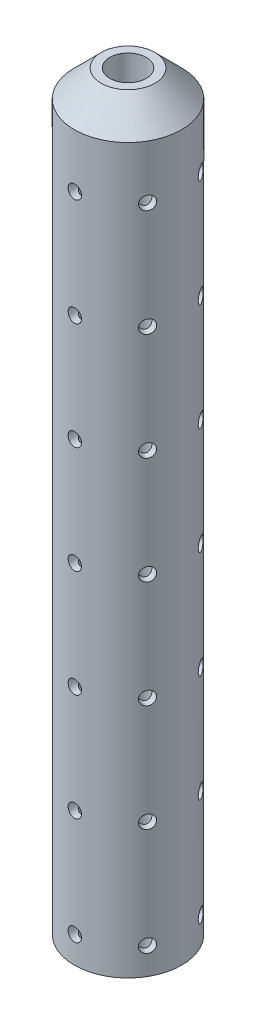
from build123d import *

# Parameters (mm, degrees)
SKETCH1_R               = 6.35
BOSS_EXTRUDE1_DEPTH     = 85.725
SKETCH2_R               = 6.35
SKETCH2_R_2             = 2.159
BOSS_EXTRUDE2_DEPTH     = 3.175
CHAMFER1_SIZE           = 3.175
SKETCH4_R               = 0.79375
CUT_EXTRUDE1_DEPTH      = 85.725
CUT_EXTRUDE2_REACH      = 93.14
CUT_EXTRUDE2_END_RADIUS = 0.79375
SKETCH3_R               = 0.79375
CIRPATTERN1_COUNT       = 6


with BuildPart() as part:
    # Sketch1 → Boss-Extrude1 (new body)
    with BuildSketch(Plane(origin=(0, 0, 0), x_dir=(1, 0, 0), z_dir=(0, 1, 0))):
        Circle(SKETCH1_R)
        Polygon((3.695503603, 0), (1.847751802, 3.2004), (-1.847751802, 3.2004), (-3.695503603, 0), (-1.847751802, -3.2004), (1.847751802, -3.2004), align=None, mode=Mode.SUBTRACT)
    extrude(amount=BOSS_EXTRUDE1_DEPTH)

    # Sketch2 → Boss-Extrude2 (add)
    with BuildSketch(Plane(origin=(0, 85.725, 0), x_dir=(1, 0, 0), z_dir=(0, 1, 0))):
        Circle(SKETCH2_R)
        Circle(SKETCH2_R_2, mode=Mode.SUBTRACT)
    extrude(amount=BOSS_EXTRUDE2_DEPTH)

    # Chamfer1
    chamfer1_edges = [part.edges().sort_by_distance(p)[0] for p in [
        (-6.35, 88.9, 0),
    ]]
    chamfer(chamfer1_edges, length=CHAMFER1_SIZE)

    # Sketch4 → Cut-Extrude1 (cut)
    with BuildSketch(Plane.XZ):
        with Locations((0, 4.7625)):
            Circle(SKETCH4_R)
    cut_extrude1 = extrude(amount=-CUT_EXTRUDE1_DEPTH, mode=Mode.SUBTRACT)

    # Cut-Extrude2: up to this cylinder (the profile starts outside it)
    cut_extrude2_end = Plane(origin=(0, 41.275, 4.7625), z_dir=(0, -1, 0)) * Cylinder(CUT_EXTRUDE2_END_RADIUS, 265.0675, mode=Mode.PRIVATE)
    # Sketch3 → Cut-Extrude2 (cut, up to the surface)
    with BuildSketch(Plane.XY.offset(12.7), mode=Mode.PRIVATE) as cut_extrude2_sk1:
        with Locations((0, 79.375)):
            Circle(SKETCH3_R)
    cut_extrude2_tool1 = extrude(cut_extrude2_sk1.sketch, amount=-CUT_EXTRUDE2_REACH, mode=Mode.PRIVATE) - cut_extrude2_end
    # Sketch3 → Cut-Extrude2 (cut, up to the surface)
    with BuildSketch(Plane.XY.offset(12.7), mode=Mode.PRIVATE) as cut_extrude2_sk2:
        with Locations((0, 66.675)):
            Circle(SKETCH3_R)
    cut_extrude2_tool2 = extrude(cut_extrude2_sk2.sketch, amount=-CUT_EXTRUDE2_REACH, mode=Mode.PRIVATE) - cut_extrude2_end
    # Sketch3 → Cut-Extrude2 (cut, up to the surface)
    with BuildSketch(Plane.XY.offset(12.7), mode=Mode.PRIVATE) as cut_extrude2_sk3:
        with Locations((0, 53.975)):
            Circle(SKETCH3_R)
    cut_extrude2_tool3 = extrude(cut_extrude2_sk3.sketch, amount=-CUT_EXTRUDE2_REACH, mode=Mode.PRIVATE) - cut_extrude2_end
    # Sketch3 → Cut-Extrude2 (cut, up to the surface)
    with BuildSketch(Plane.XY.offset(12.7), mode=Mode.PRIVATE) as cut_extrude2_sk4:
        with Locations((0, 41.275)):
            Circle(SKETCH3_R)
    cut_extrude2_tool4 = extrude(cut_extrude2_sk4.sketch, amount=-CUT_EXTRUDE2_REACH, mode=Mode.PRIVATE) - cut_extrude2_end
    # Sketch3 → Cut-Extrude2 (cut, up to the surface)
    with BuildSketch(Plane.XY.offset(12.7), mode=Mode.PRIVATE) as cut_extrude2_sk5:
        with Locations((0, 28.575)):
            Circle(SKETCH3_R)
    cut_extrude2_tool5 = extrude(cut_extrude2_sk5.sketch, amount=-CUT_EXTRUDE2_REACH, mode=Mode.PRIVATE) - cut_extrude2_end
    # Sketch3 → Cut-Extrude2 (cut, up to the surface)
    with BuildSketch(Plane.XY.offset(12.7), mode=Mode.PRIVATE) as cut_extrude2_sk6:
        with Locations((0, 15.875)):
            Circle(SKETCH3_R)
    cut_extrude2_tool6 = extrude(cut_extrude2_sk6.sketch, amount=-CUT_EXTRUDE2_REACH, mode=Mode.PRIVATE) - cut_extrude2_end
    # Sketch3 → Cut-Extrude2 (cut, up to the surface)
    with BuildSketch(Plane.XY.offset(12.7), mode=Mode.PRIVATE) as cut_extrude2_sk7:
        with Locations((0, 3.175)):
            Circle(SKETCH3_R)
    cut_extrude2_tool7 = extrude(cut_extrude2_sk7.sketch, amount=-CUT_EXTRUDE2_REACH, mode=Mode.PRIVATE) - cut_extrude2_end
    cut_extrude2 = cut_extrude2_tool1.solids().sort_by_distance((0, 79.375, 12.7))[0] + cut_extrude2_tool2.solids().sort_by_distance((0, 66.675, 12.7))[0] + cut_extrude2_tool3.solids().sort_by_distance((0, 53.975, 12.7))[0] + cut_extrude2_tool4.solids().sort_by_distance((0, 41.275, 12.7))[0] + cut_extrude2_tool5.solids().sort_by_distance((0, 28.575, 12.7))[0] + cut_extrude2_tool6.solids().sort_by_distance((0, 15.875, 12.7))[0] + cut_extrude2_tool7.solids().sort_by_distance((0, 3.175, 12.7))[0]
    add(cut_extrude2, mode=Mode.SUBTRACT)

    # CirPattern1: Cut-Extrude1, Cut-Extrude2 ×6 about axis
    cirpattern1_axis = Axis((0, 88.9, 0), (0, 1, 0))
    add([cut_extrude1.rotate(cirpattern1_axis, i * 360 / CIRPATTERN1_COUNT) for i in range(1, CIRPATTERN1_COUNT)], mode=Mode.SUBTRACT)
    add([cut_extrude2.rotate(cirpattern1_axis, i * 360 / CIRPATTERN1_COUNT) for i in range(1, CIRPATTERN1_COUNT)], mode=Mode.SUBTRACT)


solid = part.part
